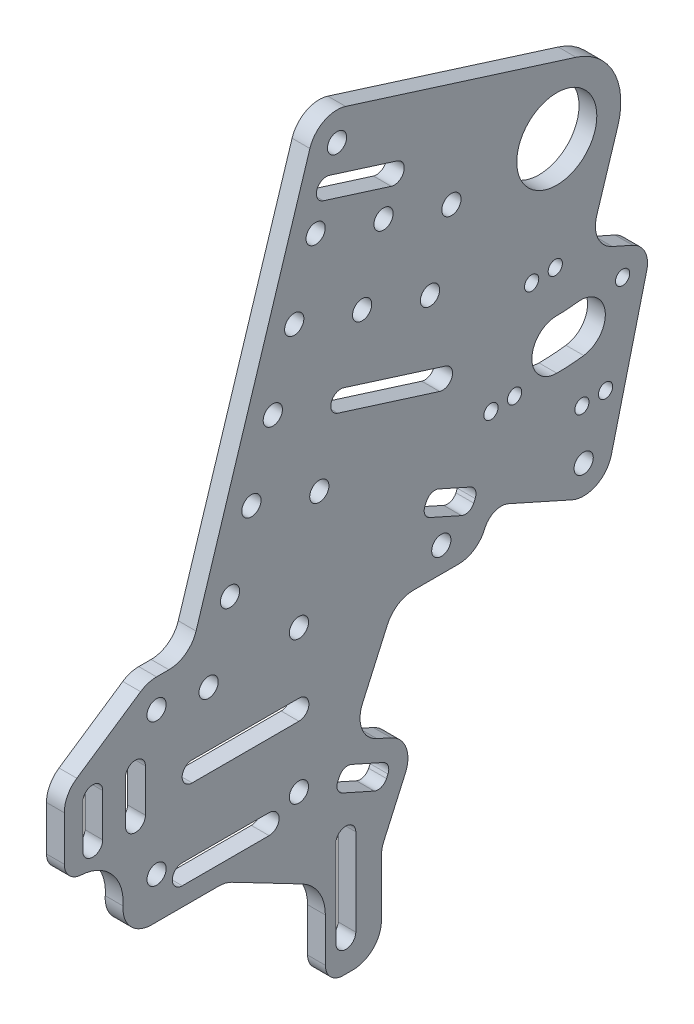
from build123d import *

# Parameters (mm, degrees)
BOSS_EXTRUDE1_DEPTH      = 3.175
BOSS_EXTRUDE1_DEPTH_BACK = 3.175
SKETCH2_R                = 14.2875
SKETCH2_R_2              = 3.429
SKETCH2_R_3              = 2.54


with BuildPart() as part:
    # Sketch2 → Boss-Extrude1 (new, two sides: drawn at the far end of the back side and taken through both)
    with BuildSketch(Plane(origin=(0, 0, 0), x_dir=(0, 0, -1), z_dir=(1, 0, 0)).offset(-BOSS_EXTRUDE1_DEPTH_BACK)):
        with BuildLine():
            Line((38.021448917, 246.234864084), (120.241230069, 220.311066665))
            ThreePointArc((120.241230069, 220.311066665), (133.644163138, 209.06467047), (135.169064986, 191.634962595))
            Line((135.169064986, 191.634962595), (127.622152065, 167.6992128))
            ThreePointArc((127.622152065, 167.6992128), (128.044603019, 160.47960856), (133.162508812, 155.36999111))
            Line((133.162508812, 155.36999111), (140.48887895, 152.092017357))
            ThreePointArc((140.48887895, 152.092017357), (144.852236282, 147.866521475), (145.483799346, 141.825426314))
            Line((145.483799346, 141.825426314), (132.821367632, 91.06703794))
            ThreePointArc((132.821367632, 91.06703794), (127.408392323, 84.390132513), (118.814072234, 84.252183312))
            Line((118.814072234, 84.252183312), (96.169597496, 94.383802715))
            ThreePointArc((96.169597496, 94.383802715), (91.311424061, 94.519907454), (87.779936097, 91.180900656))
            Line((87.779936097, 91.180900656), (87.540980013, 90.646826606))
            ThreePointArc((87.540980013, 90.646826606), (83.792669924, 86.27028604), (78.266929246, 84.636234079))
            Line((78.266929246, 84.636234079), (62.21871433, 84.636234079))
            ThreePointArc((62.21871433, 84.636234079), (56.692973652, 83.002182118), (52.944663563, 78.625641552))
            Line((52.944663563, 78.625641552), (44.041091251, 58.725889077))
            ThreePointArc((44.041091251, 58.725889077), (43.82332367, 50.95281158), (49.165734545, 45.302430837))
            Line((49.165734545, 45.302430837), (54.252907863, 43.026321345))
            ThreePointArc((54.252907863, 43.026321345), (59.595318738, 37.375940603), (59.377551157, 29.602863106))
            Line((59.377551157, 29.602863106), (51.685949233, 12.411900977))
            ThreePointArc((51.685949233, 12.411900977), (51.023955621, 10.383960474), (50.8, 8.262493504))
            Line((50.8, 8.262493504), (50.8, -11.7475))
            ThreePointArc((50.8, -11.7475), (47.824204897, -18.931704897), (40.64, -21.9075))
            Line((40.64, -21.9075), (37.1475, -21.9075))
            ThreePointArc((37.1475, -21.9075), (32.657371939, -20.047628061), (30.7975, -15.5575))
            Line((30.7975, -15.5575), (30.7975, 0))
            ThreePointArc((30.7975, 0), (28.552596998, 8.032774411), (22.468409419, 13.737834946))
            Line((22.468409419, 13.737834946), (-2.554479623, 26.788416358))
            ThreePointArc((-2.554479623, 26.788416358), (-4.834094275, 27.647905305), (-7.252780881, 27.94))
            Line((-7.252780881, 27.94), (-31.256978796, 27.94))
            ThreePointArc((-31.256978796, 27.94), (-38.707276299, 31.19213006), (-41.38801938, 38.866561592))
            ThreePointArc((-41.38801938, 38.866561592), (-45.28789684, 50.537792221), (-56.355984579, 55.915905494))
            ThreePointArc((-56.355984579, 55.915905494), (-60.621662669, 57.889989399), (-62.361270294, 62.25654206))
            Line((-62.361270294, 62.25654206), (-62.361270294, 78.164314079))
            ThreePointArc((-62.361270294, 78.164314079), (-61.17251471, 82.933210558), (-57.884425091, 86.586151856))
            Line((-57.884425091, 86.586151856), (-35.119675091, 101.948071856))
            ThreePointArc((-35.119675091, 101.948071856), (-32.408029017, 103.24198088), (-29.436520294, 103.686234079))
            Line((-29.436520294, 103.686234079), (-25.026637608, 103.686234079))
            ThreePointArc((-25.026637608, 103.686234079), (-19.01893158, 105.6527569), (-15.336873388, 110.791063156))
            Line((-15.336873388, 110.791063156), (25.276513775, 239.600270788))
            ThreePointArc((25.276513775, 239.600270788), (30.274912084, 245.55712993), (38.021448917, 246.234864084))
        make_face()
        with Locations((113.367095492, 198.509097171)):
            Circle(SKETCH2_R, mode=Mode.SUBTRACT)
        with Locations((-29.436520294, 42.726234079)):
            Circle(SKETCH2_R_2, mode=Mode.SUBTRACT)
        with Locations((21.363479706, 93.526234079)):
            Circle(SKETCH2_R_2, mode=Mode.SUBTRACT)
        with Locations((122.963479706, 93.526234079)):
            Circle(SKETCH2_R_2, mode=Mode.SUBTRACT)
        with Locations((104.398969727, 158.50014909)):
            Circle(SKETCH2_R_3, mode=Mode.SUBTRACT)
        with Locations((136.858147411, 143.977222936)):
            Circle(SKETCH2_R_3, mode=Mode.SUBTRACT)
        with Locations((122.335221257, 111.518045252)):
            Circle(SKETCH2_R_3, mode=Mode.SUBTRACT)
        with Locations((89.876043573, 126.040971407)):
            Circle(SKETCH2_R_3, mode=Mode.SUBTRACT)
        with Locations((112.840572264, 159.063757816)):
            Circle(SKETCH2_R_3, mode=Mode.SUBTRACT)
        with Locations((130.776823793, 112.081653978)):
            Circle(SKETCH2_R_3, mode=Mode.SUBTRACT)
        with Locations((98.317646109, 126.604580132)):
            Circle(SKETCH2_R_3, mode=Mode.SUBTRACT)
        with Locations((-29.436520294, 93.526234079)):
            Circle(SKETCH2_R_2, mode=Mode.SUBTRACT)
        with Locations((21.363479706, 42.726234079)):
            Circle(SKETCH2_R_2, mode=Mode.SUBTRACT)
        with Locations((72.163479706, 93.526234079)):
            Circle(SKETCH2_R_2, mode=Mode.SUBTRACT)
        with Locations((34.966277994, 236.545099865)):
            Circle(SKETCH2_R_2, mode=Mode.SUBTRACT)
        with Locations((27.328350687, 212.320689316)):
            Circle(SKETCH2_R_2, mode=Mode.SUBTRACT)
        with Locations((19.690423379, 188.096278767)):
            Circle(SKETCH2_R_2, mode=Mode.SUBTRACT)
        with Locations((12.052496072, 163.871868218)):
            Circle(SKETCH2_R_2, mode=Mode.SUBTRACT)
        with Locations((4.414568765, 139.647457669)):
            Circle(SKETCH2_R_2, mode=Mode.SUBTRACT)
        with Locations((-3.223358543, 115.42304712)):
            Circle(SKETCH2_R_2, mode=Mode.SUBTRACT)
        with Locations((-10.86128585, 91.198636571)):
            Circle(SKETCH2_R_2, mode=Mode.SUBTRACT)
        with Locations((51.552761236, 204.682762008)):
            Circle(SKETCH2_R_2, mode=Mode.SUBTRACT)
        with Locations((43.914833928, 180.458351459)):
            Circle(SKETCH2_R_2, mode=Mode.SUBTRACT)
        with Locations((75.777171785, 197.044834701)):
            Circle(SKETCH2_R_2, mode=Mode.SUBTRACT)
        with Locations((68.139244477, 172.820424152)):
            Circle(SKETCH2_R_2, mode=Mode.SUBTRACT)
        with Locations((28.638979314, 132.009530361)):
            Circle(SKETCH2_R_2, mode=Mode.SUBTRACT)
        with BuildLine():
            Line((30.078004517, 221.041477113), (54.302415066, 213.403549806))
            ThreePointArc((54.302415066, 213.403549806), (58.763142366, 215.72565746), (56.441034713, 220.18638476))
            Line((56.441034713, 220.18638476), (32.216624164, 227.824312067))
            ThreePointArc((32.216624164, 227.824312067), (27.755896864, 225.502204413), (30.078004517, 221.041477113))
        make_face(mode=Mode.SUBTRACT)
        with BuildLine():
            Line((40.124519455, 41.8507866), (51.458122437, 36.779891681))
            ThreePointArc((51.458122437, 36.779891681), (53.202214238, 34.935259556), (53.131121493, 32.397648532))
            Line((53.131121493, 32.397648532), (52.612445559, 31.238392186))
            ThreePointArc((52.612445559, 31.238392186), (50.767813434, 29.494300384), (48.23020241, 29.565393129))
            Line((48.23020241, 29.565393129), (36.896599428, 34.636288048))
            ThreePointArc((36.896599428, 34.636288048), (35.152507627, 36.480920173), (35.223600372, 39.018531197))
            Line((35.223600372, 39.018531197), (35.742276306, 40.177787543))
            ThreePointArc((35.742276306, 40.177787543), (37.586908431, 41.921879344), (40.124519455, 41.8507866))
        make_face(mode=Mode.SUBTRACT)
        with BuildLine():
            Line((66.862832351, 109.733168294), (66.344156417, 108.573911948))
            ThreePointArc((66.344156417, 108.573911948), (66.273063672, 106.036300924), (68.017155474, 104.191668799))
            Line((68.017155474, 104.191668799), (79.350758455, 99.12077388))
            ThreePointArc((79.350758455, 99.12077388), (81.88836948, 99.049681135), (83.733001605, 100.793772937))
            Line((83.733001605, 100.793772937), (84.251677539, 101.953029283))
            ThreePointArc((84.251677539, 101.953029283), (84.322770284, 104.490640307), (82.578678482, 106.335272432))
            Line((82.578678482, 106.335272432), (71.245075501, 111.406167351))
            ThreePointArc((71.245075501, 111.406167351), (68.707464477, 111.477260095), (66.862832351, 109.733168294))
        make_face(mode=Mode.SUBTRACT)
        with BuildLine():
            Line((41.656, 20.2565), (41.656, -10.7315))
            ThreePointArc((41.656, -10.7315), (38.1, -14.2875), (34.544, -10.7315))
            Line((34.544, -10.7315), (34.544, 20.2565))
            ThreePointArc((34.544, 20.2565), (38.1, 23.8125), (41.656, 20.2565))
        make_face(mode=Mode.SUBTRACT)
        with BuildLine():
            Line((-20.2565, 41.656), (10.7315, 41.656))
            ThreePointArc((10.7315, 41.656), (14.2875, 38.1), (10.7315, 34.544))
            Line((10.7315, 34.544), (-20.2565, 34.544))
            ThreePointArc((-20.2565, 34.544), (-23.8125, 38.1), (-20.2565, 41.656))
        make_face(mode=Mode.SUBTRACT)
        with BuildLine():
            Line((-48.645270294, 78.164314079), (-48.645270294, 62.924314079))
            ThreePointArc((-48.645270294, 62.924314079), (-52.201270294, 59.368314079), (-55.757270294, 62.924314079))
            Line((-55.757270294, 62.924314079), (-55.757270294, 78.164314079))
            ThreePointArc((-55.757270294, 78.164314079), (-52.201270294, 81.720314079), (-48.645270294, 78.164314079))
        make_face(mode=Mode.SUBTRACT)
        with BuildLine():
            Line((-33.405270294, 78.164314079), (-33.405270294, 62.924314079))
            ThreePointArc((-33.405270294, 62.924314079), (-36.961270294, 59.368314079), (-40.517270294, 62.924314079))
            Line((-40.517270294, 62.924314079), (-40.517270294, 78.164314079))
            ThreePointArc((-40.517270294, 78.164314079), (-36.961270294, 81.720314079), (-33.405270294, 78.164314079))
        make_face(mode=Mode.SUBTRACT)
        with BuildLine():
            Line((37.346216444, 159.625358387), (73.682832268, 148.168467426))
            ThreePointArc((73.682832268, 148.168467426), (76.004939921, 143.707740126), (71.544212621, 141.385632472))
            Line((71.544212621, 141.385632472), (35.207596798, 152.842523433))
            ThreePointArc((35.207596798, 152.842523433), (32.885489144, 157.303250733), (37.346216444, 159.625358387))
        make_face(mode=Mode.SUBTRACT)
        with BuildLine():
            Line((-16.736520294, 71.682234079), (21.363479706, 71.682234079))
            ThreePointArc((21.363479706, 71.682234079), (24.919479706, 68.126234079), (21.363479706, 64.570234079))
            Line((21.363479706, 64.570234079), (-16.736520294, 64.570234079))
            ThreePointArc((-16.736520294, 64.570234079), (-20.292520294, 68.126234079), (-16.736520294, 71.682234079))
        make_face(mode=Mode.SUBTRACT)
        with BuildLine():
            ThreePointArc((113.367095492, 126.119097171), (118.189521471, 126.279904266), (122.990522384, 126.761611119))
            ThreePointArc((122.990522384, 126.761611119), (130.619792807, 136.754530252), (120.626873673, 144.383800675))
            ThreePointArc((120.626873673, 144.383800675), (117.005065968, 144.020407787), (113.367095492, 143.899097171))
            ThreePointArc((113.367095492, 143.899097171), (104.477095492, 135.009097171), (113.367095492, 126.119097171))
        make_face(mode=Mode.SUBTRACT)
    extrude(amount=BOSS_EXTRUDE1_DEPTH + BOSS_EXTRUDE1_DEPTH_BACK)


solid = part.part
